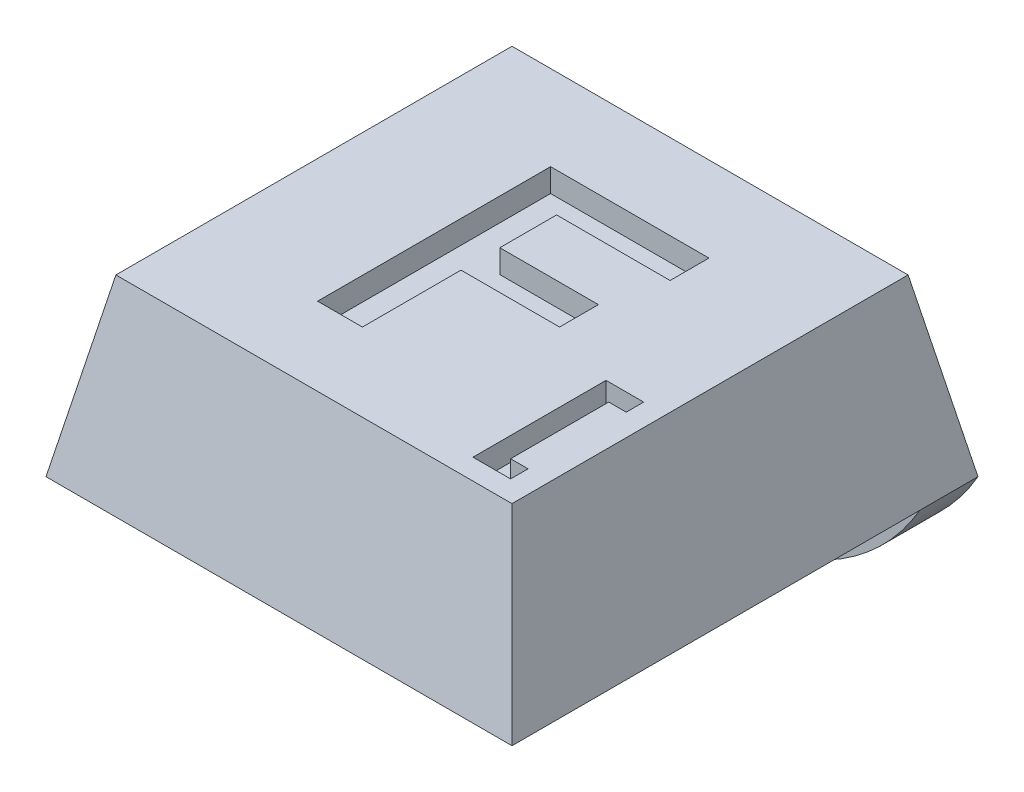
from build123d import *

# Parameters (mm, degrees)
SKETCH1_W               = 8
SKETCH1_H               = 8
BOSS_EXTRUDE1_DEPTH     = 3
CUT_EXTRUDE1_DEPTH      = 12.704699911
CUT_EXTRUDE1_DEPTH_BACK = 12.704699911
CUT_EXTRUDE2_DEPTH      = 11
SKETCH4_R               = 1.8
CUT_EXTRUDE3_DEPTH      = 0.8
SKETCH5_W               = 8
SKETCH5_H               = 1
BOSS_EXTRUDE2_DEPTH     = 2
FILLET1_R               = 4
CUT_EXTRUDE4_DEPTH      = 0.4
CUT_EXTRUDE5_DEPTH      = 0.4


with BuildPart() as part:
    # Sketch1 → Boss-Extrude1 (new body)
    with BuildSketch(Plane(origin=(0, 0, 0), x_dir=(1, 0, 0), z_dir=(0, 1, 0))):
        with Locations((4, 4)):
            Rectangle(SKETCH1_W, SKETCH1_H)
    extrude(amount=BOSS_EXTRUDE1_DEPTH)

    # Sketch2 → Cut-Extrude1 (cut, two sides: drawn at the far end of the back side and taken through both)
    with BuildSketch(Plane.XY.offset(-CUT_EXTRUDE1_DEPTH_BACK)):
        Polygon((0, 0), (0.6, 3), (0, 3), align=None)
        Polygon((8, 0), (7.4, 3), (8, 3), align=None)
    extrude(amount=CUT_EXTRUDE1_DEPTH + CUT_EXTRUDE1_DEPTH_BACK, mode=Mode.SUBTRACT)

    # Sketch3 → Cut-Extrude2 (cut)
    with BuildSketch(Plane(origin=(0, 0, 0), x_dir=(0, 0, -1), z_dir=(1, 0, 0))):
        Polygon((0, 0), (0.6, 3), (0, 3), align=None)
        Polygon((8, 3), (7.4, 3), (8, 0), align=None)
    extrude(amount=CUT_EXTRUDE2_DEPTH, mode=Mode.SUBTRACT)

    # Sketch4 → Cut-Extrude3 (cut)
    with BuildSketch(Plane.XZ):
        with Locations(Location((4, -3.75, 0), (0, 0, 270))):
            Circle(SKETCH4_R)
    extrude(amount=-CUT_EXTRUDE3_DEPTH, mode=Mode.SUBTRACT)

    # Sketch5 → Boss-Extrude2 (add)
    with BuildSketch(Plane.XZ):
        with Locations((4, -7.5)):
            Rectangle(SKETCH5_W, SKETCH5_H)
    extrude(amount=BOSS_EXTRUDE2_DEPTH)

    # Fillet1
    # the kernel refuses this fillet: 4 mm, written as the material it takes off along each edge
    with BuildSketch(Plane(origin=(8, -2, -16.660254038), x_dir=(0, 1, 0), z_dir=(0, 0, 1)), Plane(origin=(0, -2, 1.660254038), x_dir=(0, 1, 0), z_dir=(0, 0, -1))) as fillet1_piece_1:
        with BuildLine():
            CenterArc((4, 3.464101615), FILLET1_R, 180, 60)
            Line((0, 3.464101615), (-0.08, 3.464101615))
            Line((-0.08, 3.464101615), (-0.08, 0))
            Line((-0.08, 0), (0, -0.08))
            ThreePointArc((0, -0.08), (1, -0.08), (1.96, -0.069282032))
            Line((1.96, -0.069282032), (2, 0))
        make_face()
    extrude(amount=18.320508076, mode=Mode.SUBTRACT)

    # Sketch6 → Cut-Extrude4 (cut)
    with BuildSketch(Plane(origin=(0, 3, 0), x_dir=(1, 0, 0), z_dir=(0, 1, 0))):
        Polygon((2.721575188, 1.941169366), (2.721575188, 5.941169366), (5.439523906, 5.941169366), (5.439523906, 5.2745027), (3.490805957, 5.2745027), (3.490805957, 4.300143725), (5.18311365, 4.300143725), (5.18311365, 3.633477059), (3.490805957, 3.633477059), (3.490805957, 1.941169366), align=None)
    extrude(amount=-CUT_EXTRUDE4_DEPTH, mode=Mode.SUBTRACT)

    # Sketch7 → Cut-Extrude5 (cut)
    with BuildSketch(Plane(origin=(0, 3, 0), x_dir=(1, 0, 0), z_dir=(0, 1, 0))):
        Polygon((6.374503362, 0.955347226), (6.374503362, 3.239962611), (7.020657208, 3.239962611), (7.020657208, 2.939962611), (6.720657208, 2.939962611), (6.720657208, 1.255347226), (7.020657208, 1.255347226), (7.020657208, 0.955347226), align=None)
    extrude(amount=-CUT_EXTRUDE5_DEPTH, mode=Mode.SUBTRACT)


solid = part.part
